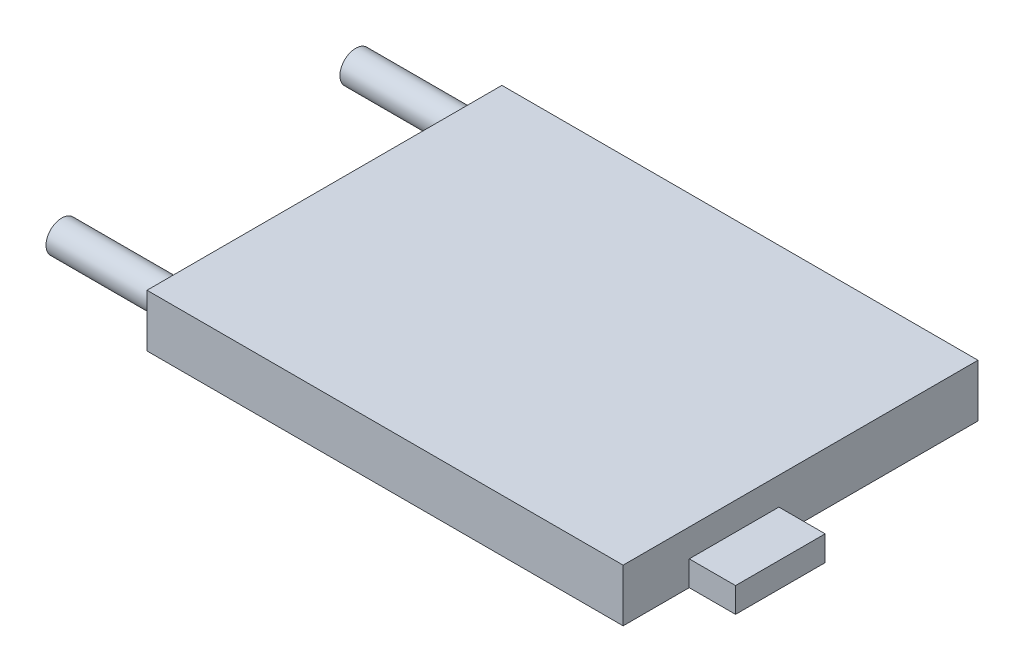
from build123d import *

# Parameters (mm, degrees)
SKETCH1_W           = 82.296
SKETCH1_H           = 61.341
BOSS_EXTRUDE1_DEPTH = 9.0932
SKETCH2_R           = 2.7305
BOSS_EXTRUDE2_DEPTH = 20
SKETCH3_W           = 15.494
SKETCH3_H           = 4.318
BOSS_EXTRUDE3_DEPTH = 8


with BuildPart() as part:
    # Sketch1 → Boss-Extrude1 (new body)
    with BuildSketch(Plane(origin=(0, 0, 0), x_dir=(1, 0, 0), z_dir=(0, 1, 0))):
        Rectangle(SKETCH1_W, SKETCH1_H)
    extrude(amount=BOSS_EXTRUDE1_DEPTH)

    # Sketch2 → Boss-Extrude2 (add)
    with BuildSketch(Plane.ZY.offset(41.148)):
        with Locations((-25.4, 4.5466)):
            Circle(SKETCH2_R)
        with Locations((25.4, 4.5466)):
            Circle(SKETCH2_R)
    extrude(amount=BOSS_EXTRUDE2_DEPTH)

    # Sketch3 → Boss-Extrude3 (add)
    with BuildSketch(Plane(origin=(41.148, 0, 0), x_dir=(0, 0, -1), z_dir=(1, 0, 0))):
        with Locations((-11.4935, 2.159)):
            Rectangle(SKETCH3_W, SKETCH3_H)
    extrude(amount=BOSS_EXTRUDE3_DEPTH)


solid = part.part
